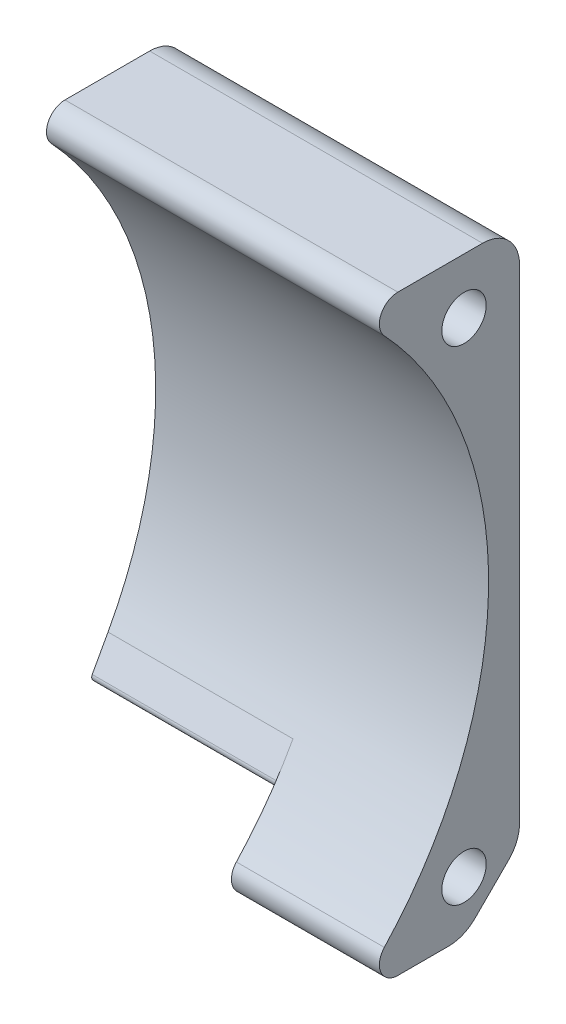
from build123d import *

# Parameters (mm, degrees)
BOSS_EXTRUDE1_DEPTH = 28.575
CHAMFER1_SIZE       = 4.7625
FILLET3_R           = 3.175
CUT_EXTRUDE1_START  = -12.7
CUT_EXTRUDE1_DEPTH  = 48.337684469
FILLET4_R           = 0.396875
FILLET5_R           = 3.175
FILLET6_R           = 1.5875
SKETCH3_R           = 1.905
CUT_EXTRUDE2_DEPTH  = 60.514034165


with BuildPart() as part:
    # Sketch1 → Boss-Extrude1 (new body)
    with BuildSketch(Plane(origin=(0, 0, 0), x_dir=(0, 0, -1), z_dir=(1, 0, 0))):
        with BuildLine():
            Line((0, 0), (-14.399754562, 0))
            ThreePointArc((-14.399754562, 0), (-2.654588994, -25.4), (-14.399754562, -50.8))
            Line((-14.399754562, -50.8), (0, -50.8))
            Line((0, -50.8), (0, 0))
        make_face()
    extrude(amount=BOSS_EXTRUDE1_DEPTH)

    # Chamfer1
    chamfer1_edges = [part.edges().sort_by_distance(p)[0] for p in [
        (14.2875, -50.8, 0),
    ]]
    chamfer(chamfer1_edges, length=CHAMFER1_SIZE)

    # Fillet3
    fillet3_edges = [part.edges().sort_by_distance(p)[0] for p in [
        (14.2875, -50.8, 4.7625),
        (14.2875, -46.0375, 0),
    ]]
    fillet(fillet3_edges, radius=FILLET3_R)

    # Sketch2 → Cut-Extrude1 (cut, through all)
    with BuildSketch(Plane(origin=(28.575, 0, 0), x_dir=(0, 0, -1), z_dir=(1, 0, 0)).offset(CUT_EXTRUDE1_START)):
        with BuildLine():
            Line((-9.432233183, -46.309871939), (-6.747973263, -41.405330404))
            ThreePointArc((-6.747973263, -41.405330404), (-10.143469679, -46.453213193), (-14.399754562, -50.8))
            Line((-14.399754562, -50.8), (-6.077628061, -50.8))
            ThreePointArc((-6.077628061, -50.8), (-4.862608163, -50.558317516), (-3.83256403, -49.87006403))
            Line((-3.83256403, -49.87006403), (-0.92993597, -46.96743597))
            ThreePointArc((-0.92993597, -46.96743597), (-0.583051244, -46.556064021), (-0.31061766, -46.092021096))
            Line((-0.31061766, -46.092021096), (-4.7625, -41.640138757))
            Line((-4.7625, -41.640138757), (-9.432233183, -46.309871939))
        make_face()
    extrude(amount=-CUT_EXTRUDE1_DEPTH, mode=Mode.SUBTRACT)

    # Fillet4
    fillet4_edges = [part.edges().sort_by_distance(p)[0] for p in [
        (7.9375, -46.309871939, 9.432233183),
    ]]
    fillet(fillet4_edges, radius=FILLET4_R)

    # Fillet5
    fillet5_edges = [part.edges().sort_by_distance(p)[0] for p in [
        (14.2875, 0, 0),
    ]]
    fillet(fillet5_edges, radius=FILLET5_R)

    # Fillet6
    fillet6_edges = [part.edges().sort_by_distance(p)[0] for p in [
        (22.225, -50.8, 14.399754562),
        (14.2875, 0, 14.399754562),
    ]]
    fillet(fillet6_edges, radius=FILLET6_R)

    # Sketch3 → Cut-Extrude2 (cut, through all)
    with BuildSketch(Plane(origin=(28.575, 0, 0), x_dir=(0, 0, -1), z_dir=(1, 0, 0))):
        with Locations((-4.7625, -4.7625)):
            Circle(SKETCH3_R)
        with Locations((-4.7625, -46.309871939)):
            Circle(SKETCH3_R)
    extrude(amount=-CUT_EXTRUDE2_DEPTH, mode=Mode.SUBTRACT)


solid = part.part
